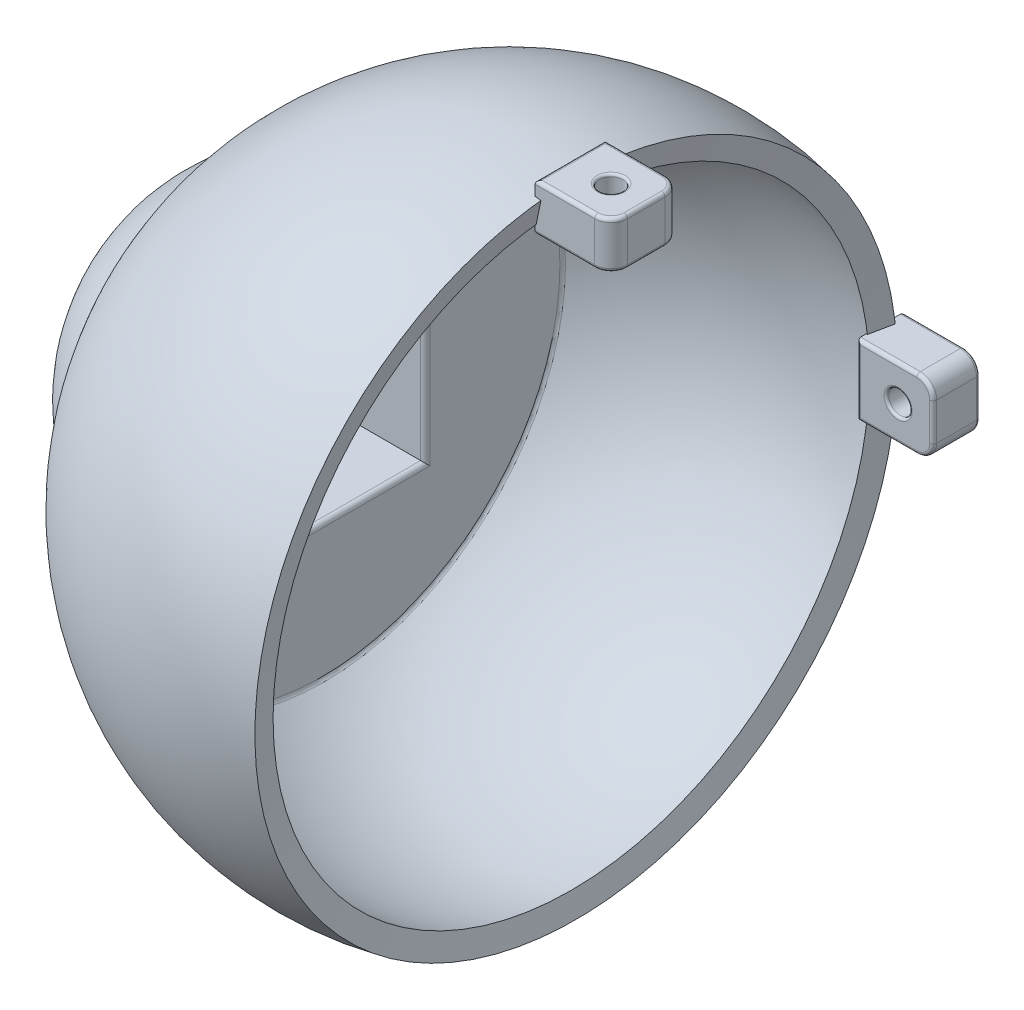
from build123d import *

# Parameters (mm, degrees)
SHELL3_T                        = -1
SKETCH3_R                       = 4.25
CUT_EXTRUDE2_DEPTH              = 71
EXTRUDE_THIN1_REACH             = 26.74
EXTRUDE_THIN1_END_RADIUS        = 7.082903769
SKETCH6_W                       = 9.8
SKETCH6_H                       = 9.911877538
SKETCH6_W_2                     = 8.8
SKETCH6_H_2                     = 8.911877538
EXTRUDE_THIN1_DIRECTION_2_DEPTH = 4
BOSS_EXTRUDE5_REACH             = 26.38
BOSS_EXTRUDE5_END_RADIUS        = 7.082903769
SKETCH8_W                       = 8.8
SKETCH8_H                       = 8.911877538
SKETCH8_R                       = 4.25
BOSS_EXTRUDE7_REACH             = 29.912
BOSS_EXTRUDE7_END_RADIUS        = 13
BOSS_EXTRUDE8_REACH             = 29.912
BOSS_EXTRUDE8_END_RADIUS        = 13
BOSS_EXTRUDE9_REACH             = 29.874
BOSS_EXTRUDE9_END_RADIUS        = 13
BOSS_EXTRUDE10_REACH            = 29.874
BOSS_EXTRUDE10_END_RADIUS       = 13
BOSS_EXTRUDE11_START            = 0.25
BOSS_EXTRUDE11_DEPTH            = 2
SKETCH17_R                      = 0.5
CUT_EXTRUDE3_DEPTH              = 2
FILLET1_R                       = 0.7
FILLET2_R                       = 0.15
FILLET9_R                       = 0.1
CIRPATTERN4_COUNT               = 2
CIRPATTERN4_ANGLE               = 90
FILLET6_R                       = 0.2
FILLET7_R                       = 0.2
FILLET8_R                       = 0.4


with BuildPart() as part:
    # Sketch2 → Revolve1 (revolve)
    with BuildSketch(Plane.XY):
        with BuildLine():
            Line((0, 0), (2.834192463, 13.710118639))
            ThreePointArc((2.834192463, 13.710118639), (-5.730026707, 12.773675819), (-12.124355653, 7))
            ThreePointArc((-12.124355653, 7), (-15.082903769, 4.041451884), (-16.165807537, 0))
            Line((-16.165807537, 0), (0, 0))
        make_face()
    revolve(axis=Axis((0, 0, 0), (-1, 0, 0)))

    # Shell3
    shell3_openings = [part.faces().sort_by_distance(p)[0] for p in [
        (1.417096231, -6.855059319, 0),
    ]]
    offset(amount=SHELL3_T, openings=shell3_openings, kind=Kind.INTERSECTION)

    # Sketch3 → Cut-Extrude2 (cut)
    with BuildSketch(Plane(origin=(0, 0, 0), x_dir=(0, 0, -1), z_dir=(1, 0, 0))):
        Circle(SKETCH3_R)
    extrude(amount=-CUT_EXTRUDE2_DEPTH, mode=Mode.SUBTRACT)

    # Extrude-Thin1: up to this sphere (the profile starts inside it)
    extrude_thin1_end = Location((-8.082903769, 0, 0)) * Sphere(EXTRUDE_THIN1_END_RADIUS, mode=Mode.PRIVATE)
    # Sketch6 → Extrude-Thin1 (add, up to the surface)
    with BuildSketch(Plane(origin=(-12, 0, 0), x_dir=(0, 0, -1), z_dir=(1, 0, 0)), mode=Mode.PRIVATE) as extrude_thin1_sk1:
        Rectangle(SKETCH6_W, SKETCH6_H)
        Rectangle(SKETCH6_W_2, SKETCH6_H_2, mode=Mode.SUBTRACT)
    extrude_thin1_tool1 = extrude(extrude_thin1_sk1.sketch, amount=-EXTRUDE_THIN1_REACH, mode=Mode.PRIVATE) & extrude_thin1_end
    add(extrude_thin1_tool1.solids().sort_by_distance((-12, -4.816553, 0))[0])
    add(extrude_thin1_tool1.solids().sort_by_distance((-12, -4.816553, 0))[1])
    add(extrude_thin1_tool1.solids().sort_by_distance((-12, -4.816553, 0))[2])
    add(extrude_thin1_tool1.solids().sort_by_distance((-12, -4.816553, 0))[3])

    # Sketch6 → Extrude-Thin1 direction 2 (add)
    with BuildSketch(Plane(origin=(-12, 0, 0), x_dir=(0, 0, -1), z_dir=(1, 0, 0))):
        Rectangle(SKETCH6_W, SKETCH6_H)
        Rectangle(SKETCH6_W_2, SKETCH6_H_2, mode=Mode.SUBTRACT)
    extrude(amount=EXTRUDE_THIN1_DIRECTION_2_DEPTH)

    # Boss-Extrude5: up to this sphere (the profile starts inside it)
    boss_extrude5_end = Location((-8.082903769, 0, 0)) * Sphere(BOSS_EXTRUDE5_END_RADIUS, mode=Mode.PRIVATE)
    # Sketch8 → Boss-Extrude5 (add, up to the surface)
    with BuildSketch(Plane(origin=(-11.392304845, 0, 0), x_dir=(0, 0, -1), z_dir=(1, 0, 0)), mode=Mode.PRIVATE) as boss_extrude5_sk1:
        Rectangle(SKETCH8_W, SKETCH8_H)
        Circle(SKETCH8_R, mode=Mode.SUBTRACT)
    boss_extrude5_tool1 = extrude(boss_extrude5_sk1.sketch, amount=-BOSS_EXTRUDE5_REACH, mode=Mode.PRIVATE) & boss_extrude5_end
    add(boss_extrude5_tool1.solids().sort_by_distance((-11.392305, 4.330694, 0))[0])

    # Boss-Extrude7: up to this sphere (the profile starts inside it)
    boss_extrude7_end = Location((0, 0, 0)) * Sphere(BOSS_EXTRUDE7_END_RADIUS, mode=Mode.PRIVATE)
    # Sketch12 → Boss-Extrude7 (add, up to the surface)
    with BuildSketch(Plane(origin=(0, 4.955938769, 0), x_dir=(1, 0, 0), z_dir=(0, 1, 0)), mode=Mode.PRIVATE) as boss_extrude7_sk1:
        with BuildLine():
            Line((-10.973999769, -4.9), (-8, -4.9))
            Line((-8, -4.9), (-8, 4.9))
            Line((-8, 4.9), (-10.973999769, 4.9))
            ThreePointArc((-10.973999769, 4.9), (-11.195988483, 4.369040262), (-11.392304845, 3.828062334))
            ThreePointArc((-11.392304845, 3.828062334), (-13.143160355, 0), (-11.392304845, -3.828062334))
            ThreePointArc((-11.392304845, -3.828062334), (-11.195988483, -4.369040262), (-10.973999769, -4.9))
        make_face()
    boss_extrude7_tool1 = extrude(boss_extrude7_sk1.sketch, amount=BOSS_EXTRUDE7_REACH, mode=Mode.PRIVATE) & boss_extrude7_end
    add(boss_extrude7_tool1.solids().sort_by_distance((-10.21205, 4.955939, 0))[0])

    # Boss-Extrude8: up to this sphere (the profile starts inside it)
    boss_extrude8_end = Location((0, 0, 0)) * Sphere(BOSS_EXTRUDE8_END_RADIUS, mode=Mode.PRIVATE)
    # Sketch13 → Boss-Extrude8 (add, up to the surface)
    with BuildSketch(Plane.XZ.offset(4.955938769), mode=Mode.PRIVATE) as boss_extrude8_sk1:
        with BuildLine():
            Line((-10.973999769, -4.9), (-8, -4.9))
            Line((-8, -4.9), (-8, 4.9))
            Line((-8, 4.9), (-10.973999769, 4.9))
            ThreePointArc((-10.973999769, 4.9), (-11.195988483, 4.369040262), (-11.392304845, 3.828062334))
            ThreePointArc((-11.392304845, 3.828062334), (-13.143160355, 0), (-11.392304845, -3.828062334))
            ThreePointArc((-11.392304845, -3.828062334), (-11.195988483, -4.369040262), (-10.973999769, -4.9))
        make_face()
    boss_extrude8_tool1 = extrude(boss_extrude8_sk1.sketch, amount=BOSS_EXTRUDE8_REACH, mode=Mode.PRIVATE) & boss_extrude8_end
    add(boss_extrude8_tool1.solids().sort_by_distance((-10.21205, -4.955939, 0))[0])

    # Boss-Extrude9: up to this sphere (the profile starts inside it)
    boss_extrude9_end = Location((0, 0, 0)) * Sphere(BOSS_EXTRUDE9_END_RADIUS, mode=Mode.PRIVATE)
    # Sketch14 → Boss-Extrude9 (add, up to the surface)
    with BuildSketch(Plane.XY.offset(4.9), mode=Mode.PRIVATE) as boss_extrude9_sk1:
        with BuildLine():
            Line((-8, -8.999444427), (-8, 8.999444427))
            ThreePointArc((-8, 8.999444427), (-10.025864662, 6.668735846), (-11.392304845, 3.899408969))
            ThreePointArc((-11.392304845, 3.899408969), (-13.197346631, 0), (-11.392304845, -3.899408969))
            ThreePointArc((-11.392304845, -3.899408969), (-10.025864662, -6.668735846), (-8, -8.999444427))
        make_face()
    boss_extrude9_tool1 = extrude(boss_extrude9_sk1.sketch, amount=BOSS_EXTRUDE9_REACH, mode=Mode.PRIVATE) & boss_extrude9_end
    add(boss_extrude9_tool1.solids().sort_by_distance((-9.949858, 0, 4.9))[0])

    # Boss-Extrude10: up to this sphere (the profile starts inside it)
    boss_extrude10_end = Location((0, 0, 0)) * Sphere(BOSS_EXTRUDE10_END_RADIUS, mode=Mode.PRIVATE)
    # Sketch15 → Boss-Extrude10 (add, up to the surface)
    with BuildSketch(Plane(origin=(0, 0, -4.9), x_dir=(-1, 0, 0), z_dir=(0, 0, -1)), mode=Mode.PRIVATE) as boss_extrude10_sk1:
        with BuildLine():
            Line((8, 8.999444427), (8, -8.999444427))
            ThreePointArc((8, -8.999444427), (10.025864662, -6.668735846), (11.392304845, -3.899408969))
            ThreePointArc((11.392304845, -3.899408969), (13.197346631, 0), (11.392304845, 3.899408969))
            ThreePointArc((11.392304845, 3.899408969), (10.025864662, 6.668735846), (8, 8.999444427))
        make_face()
    boss_extrude10_tool1 = extrude(boss_extrude10_sk1.sketch, amount=BOSS_EXTRUDE10_REACH, mode=Mode.PRIVATE) & boss_extrude10_end
    add(boss_extrude10_tool1.solids().sort_by_distance((-9.949858, 0, -4.9))[0])

    # Fillet6
    fillet6_edges = [part.edges().sort_by_distance(p)[0] for p in [
        (-8, 0, 4.4),
        (-8, -4.455938769, 0),
        (-8, 0, -4.4),
        (-8, 4.455938769, 0),
        (-8, -10.246950766, 0),
    ]]
    fillet(fillet6_edges, radius=FILLET6_R)

    # Fillet7
    fillet7_edges = [part.edges().sort_by_distance(p)[0] for p in [
        (-14.958282546, 3.00520382, -3.00520382),
        (-11.392304845, 0, 4.25),
    ]]
    fillet(fillet7_edges, radius=FILLET7_R)

    # Fillet8
    fillet8_edges = [part.edges().sort_by_distance(p)[0] for p in [
        (-12.124355653, -7, 0),
    ]]
    fillet(fillet8_edges, radius=FILLET8_R)


with BuildPart() as body_2:
    # Sketch16 → Boss-Extrude11 (new body)
    with BuildSketch(Plane(origin=(0, 0, -14), x_dir=(-1, 0, 0), z_dir=(0, 0, -1)).offset(BOSS_EXTRUDE11_START)):
        Polygon((-5.834192463, 1.5), (-2.834192463, 1.5), (-2.584192463, 1.5), (-2.584192463, -1.5), (-2.834192463, -1.5), (-5.834192463, -1.5), align=None)
    extrude(amount=-BOSS_EXTRUDE11_DEPTH)

    # Sketch17 → Cut-Extrude3 (cut)
    with BuildSketch(Plane(origin=(0, 13.25, -14.25), x_dir=(1, 0, 0), z_dir=(0, 0, 1))):
        with Locations((4.334192463, -13.25)):
            Circle(SKETCH17_R)
    extrude(amount=CUT_EXTRUDE3_DEPTH, mode=Mode.SUBTRACT)

    # Fillet1
    fillet1_edges = [body_2.edges().sort_by_distance(p)[0] for p in [
        (5.834192463, -1.5, -13.25),
        (5.834192463, 1.5, -13.25),
    ]]
    fillet(fillet1_edges, radius=FILLET1_R)

    # Fillet2
    fillet2_edges = [body_2.edges().sort_by_distance(p)[0] for p in [
        (3.859192463, 1.5, -14.25),
        (3.859192463, 1.5, -12.25),
        (3.859192463, -1.5, -12.25),
        (3.859192463, -1.5, -14.25),
        (2.584192463, 0, -12.25),
        (2.584192463, 0, -14.25),
        (5.62916721, -1.294974747, -14.25),
        (5.834192463, 0, -14.25),
        (5.62916721, 1.294974747, -14.25),
        (5.62916721, -1.294974747, -12.25),
        (5.834192463, 0, -12.25),
        (5.62916721, 1.294974747, -12.25),
    ]]
    fillet(fillet2_edges, radius=FILLET2_R)

    # Fillet9
    fillet9_edges = [body_2.edges().sort_by_distance(p)[0] for p in [
        (3.834192463, 0, -12.25),
        (3.834192463, 0, -14.25),
    ]]
    fillet(fillet9_edges, radius=FILLET9_R)


with BuildPart() as cirpattern4_1:
    # CirPattern4: pattern copy
    add(body_2.part.rotate(Axis((-17.248382677, 0, 0), (1, 0, 0)), 1 * CIRPATTERN4_ANGLE / (CIRPATTERN4_COUNT - 1)))


solid = Compound([part.part, body_2.part, cirpattern4_1.part])
